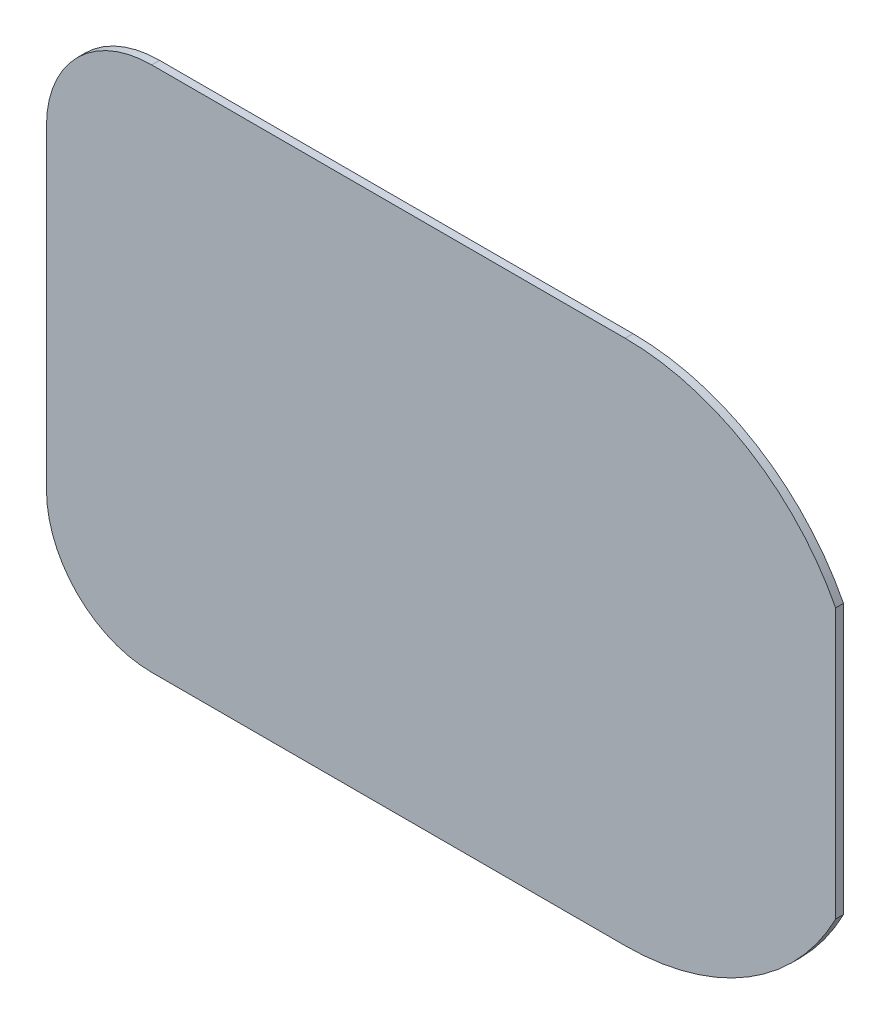
from build123d import *

# Parameters (mm, degrees)
EXTRUDE_1_DEPTH         = 3
EXTRUDE_START           = -42
EXTRUDE_2_OUTLINE_W     = 3
EXTRUDE_2_OUTLINE_H     = 100
EXTRUDE_2_DEPTH         = 41
EXTRUDE_START_2         = -1
EXTRUDE_2_2_OUTLINE_R   = 2
EXTRUDE_2_2_OUTLINE_W   = 10
EXTRUDE_2_2_OUTLINE_H   = 120
EXTRUDE_2_2_OUTLINE_R_2 = 52
EXTRUDE_2_2_DEPTH       = 4
EXTRUDE_START_3         = -47
EXTRUDE_2_3_OUTLINE_W   = 3
EXTRUDE_2_3_OUTLINE_H   = 100
EXTRUDE_2_3_DEPTH       = 5
EXTRUDE_2_4_DEPTH       = 180
EXTRUDE_START_4         = -5
EXTRUDE_2_5_DEPTH       = 5
EXTRUDE_START_5         = -3
SKETCH_3_R              = 52
SKETCH_3_W              = 10
SKETCH_3_H              = 120
EXTRUDE_3_DEPTH         = 3
SKETCH_4_R              = 2
EXTRUDE_4_DEPTH         = 3
EXTRUDE_START_6         = -56
SKETCH_5_R              = 2
EXTRUDE_5_DEPTH         = 56
SKETCH_6_W              = 375.582573206
SKETCH_6_H              = 223.737414549
CUT_EXTRUDE_1_DEPTH     = 70
CUT_EXTRUDE_2_DEPTH     = 126
SKETCH_8_W              = 410.596490254
SKETCH_8_H              = 121.986596881
CUT_EXTRUDE_3_DEPTH     = 10
SKETCH_9_W              = 309.492357762
SKETCH_9_H              = 10
EXTRUDE_6_DEPTH         = 3
SKETCH_10_W             = 76.162490496
SKETCH_10_H             = 157.997962214
CUT_EXTRUDE_4_DEPTH     = 10


with BuildPart() as part:
    # 草图1 → 凸台-拉伸1 (new body)
    with BuildSketch(Plane(origin=(-1, 0, 0), x_dir=(0, 0, -1), z_dir=(1, 0, 0))):
        Polygon((33.371794872, 92.353263785), (31.902170139, 91.718942203), (33.371794872, 91.084620622), align=None)
    extrude(amount=-EXTRUDE_1_DEPTH)

    # 凸台-拉伸2: read off the stored shape, not the designer's step
    # 凸台-拉伸2 outline → 凸台-拉伸2 (add)
    with BuildSketch(Plane.XY.offset(EXTRUDE_START)):
        with Locations((-2.5, 90)):
            Rectangle(EXTRUDE_2_OUTLINE_W, EXTRUDE_2_OUTLINE_H)
    extrude(amount=EXTRUDE_2_DEPTH)

    # Extrude 2 2 outline → Extrude 2 2 (add)
    with BuildSketch(Plane.XY.offset(EXTRUDE_START_2)):
        with BuildLine():
            Line((-4, 140), (-4, 40))
            Line((-4, 40), (0, 40))
            ThreePointArc((0, 40), (11.715728753, 11.715728753), (40, 0))
            Line((40, 0), (220, 0))
            ThreePointArc((220, 0), (310, 90), (220, 180))
            Line((220, 180), (40, 180))
            ThreePointArc((40, 180), (11.715728753, 168.284271247), (0, 140))
            Line((0, 140), (-4, 140))
        make_face()
        with Locations((248.3, 165.059930776)):
            Circle(EXTRUDE_2_2_OUTLINE_R, mode=Mode.SUBTRACT)
        with Locations((28, 14)):
            Circle(EXTRUDE_2_2_OUTLINE_R, mode=Mode.SUBTRACT)
        with Locations((139.15, 14)):
            Circle(EXTRUDE_2_2_OUTLINE_R, mode=Mode.SUBTRACT)
        with Locations((27.7366, 79.2634)):
            Circle(EXTRUDE_2_2_OUTLINE_R, mode=Mode.SUBTRACT)
        with Locations((248.3, 14.940069224)):
            Circle(EXTRUDE_2_2_OUTLINE_R, mode=Mode.SUBTRACT)
        with Locations((27.7366, 104.2634)):
            Circle(EXTRUDE_2_2_OUTLINE_R, mode=Mode.SUBTRACT)
        with Locations((107.15, 90)):
            Rectangle(EXTRUDE_2_2_OUTLINE_W, EXTRUDE_2_2_OUTLINE_H, mode=Mode.SUBTRACT)
        with Locations((137.15, 90)):
            Rectangle(EXTRUDE_2_2_OUTLINE_W, EXTRUDE_2_2_OUTLINE_H, mode=Mode.SUBTRACT)
        with Locations((28, 166)):
            Circle(EXTRUDE_2_2_OUTLINE_R, mode=Mode.SUBTRACT)
        with Locations((139.15, 166)):
            Circle(EXTRUDE_2_2_OUTLINE_R, mode=Mode.SUBTRACT)
        with Locations((220, 90)):
            Circle(EXTRUDE_2_2_OUTLINE_R_2, mode=Mode.SUBTRACT)
    extrude(amount=EXTRUDE_2_2_DEPTH)

    # Extrude 2 3 outline → Extrude 2 3 (add)
    with BuildSketch(Plane.XY.offset(EXTRUDE_START_3)):
        with Locations((-2.5, 90)):
            Rectangle(EXTRUDE_2_3_OUTLINE_W, EXTRUDE_2_3_OUTLINE_H)
    extrude(amount=EXTRUDE_2_3_DEPTH)

    # Extrude 2 4 outline → Extrude 2 4 (cut)
    with BuildSketch(Plane(origin=(0, 0, 0), x_dir=(1, 0, 0), z_dir=(0, 1, 0))):
        with BuildLine():
            Line((311, 0), (311, 1))
            Line((311, 1), (-1, 1))
            ThreePointArc((-1, 1), (-0.707106781, 0.292893219), (0, 0))
            Line((0, 0), (311, 0))
        make_face()
        with BuildLine():
            Line((102.15, -4), (102.15, -3))
            Line((102.15, -3), (0, -3))
            ThreePointArc((0, -3), (-2.828427125, -1.828427125), (-4, 1))
            Line((-4, 1), (-4, 2))
            Line((-4, 2), (-5, 2))
            Line((-5, 2), (-5, -4))
            Line((-5, -4), (102.15, -4))
        make_face()
    extrude(amount=EXTRUDE_2_4_DEPTH, mode=Mode.SUBTRACT)

    # Extrude 2 5 outline → Extrude 2 5 (cut)
    with BuildSketch(Plane.YZ.offset(EXTRUDE_START_4)):
        with BuildLine():
            ThreePointArc((45, -47), (41.464466094, -45.535533906), (40, -42))
            Line((40, -42), (40, -41))
            Line((40, -41), (39, -41))
            Line((39, -41), (39, -46.999999996))
            Line((39, -46.999999996), (45, -47))
        make_face()
        with BuildLine():
            ThreePointArc((140, -42), (138.535533906, -45.535533906), (135, -47))
            Line((135, -47), (141, -46.999999996))
            Line((141, -46.999999996), (141, -41))
            Line((141, -41), (140, -41))
            Line((140, -41), (140, -42))
        make_face()
    extrude(amount=EXTRUDE_2_5_DEPTH, mode=Mode.SUBTRACT)

    # 草图3 → 凸台-拉伸3 (add)
    with BuildSketch(Plane.XY.offset(3).offset(EXTRUDE_START_5)):
        with Locations((220, 90)):
            Circle(SKETCH_3_R)
        with Locations((107.15, 90)):
            Rectangle(SKETCH_3_W, SKETCH_3_H)
        with Locations((137.15, 90)):
            Rectangle(SKETCH_3_W, SKETCH_3_H)
    extrude(amount=EXTRUDE_3_DEPTH)

    # 草图4 → 凸台-拉伸4 (add)
    with BuildSketch(Plane.XY.offset(3).offset(EXTRUDE_START_5)):
        with Locations((27.7366, 79.2634)):
            Circle(SKETCH_4_R)
        with Locations((27.7366, 104.2634)):
            Circle(SKETCH_4_R)
    extrude(amount=EXTRUDE_4_DEPTH)

    # 草图5 → 凸台-拉伸5 (add)
    with BuildSketch(Plane.XY.offset(3).offset(EXTRUDE_START_6)):
        with Locations((248.3, 14.940069224)):
            Circle(SKETCH_5_R)
        with Locations((139.15, 14)):
            Circle(SKETCH_5_R)
        with Locations((248.3, 165.059930776)):
            Circle(SKETCH_5_R)
        with Locations((139.15, 166)):
            Circle(SKETCH_5_R)
        with Locations((28, 14)):
            Circle(SKETCH_5_R)
        with Locations((28, 166)):
            Circle(SKETCH_5_R)
    extrude(amount=EXTRUDE_5_DEPTH)

    # 草图6 → 切除-拉伸1 (cut)
    with BuildSketch(Plane(origin=(0, 0, 0), x_dir=(-1, 0, 0), z_dir=(0, 0, -1))):
        with Locations((-149.296459545, 93.267829814)):
            Rectangle(SKETCH_6_W, SKETCH_6_H)
    extrude(amount=CUT_EXTRUDE_1_DEPTH, mode=Mode.SUBTRACT)

    # 草图7 → 切除-拉伸2 (cut)
    with BuildSketch(Plane.XZ.offset(-40)):
        with BuildLine():
            Line((-3.872983346, 0), (0, 0))
            Line((0, 0), (0, 3))
            ThreePointArc((0, 3), (-2.449489743, 2.16227766), (-3.872983346, 0))
        make_face()
    extrude(amount=-CUT_EXTRUDE_2_DEPTH, mode=Mode.SUBTRACT)

    # 草图8 → 切除-拉伸3 (cut)
    with BuildSketch(Plane(origin=(0, 0, 0), x_dir=(-1, 0, 0), z_dir=(0, 0, -1))):
        with Locations((-160.461750975, 150.993298441)):
            Rectangle(SKETCH_8_W, SKETCH_8_H)
    extrude(amount=-CUT_EXTRUDE_3_DEPTH, mode=Mode.SUBTRACT)

    # 草图9 → 凸台-拉伸6 (add)
    with BuildSketch(Plane(origin=(0, 0, 0), x_dir=(-1, 0, 0), z_dir=(0, 0, -1))):
        with Locations((-154.746178881, 95)):
            Rectangle(SKETCH_9_W, SKETCH_9_H)
    extrude(amount=-EXTRUDE_6_DEPTH)

    # 镜向1: part across plane


with BuildPart() as part_1:
    add(part.part)
    add(part.part.mirror(Plane(origin=(309.492357762, 100, 312.653870495), x_dir=(0, 0, 1), z_dir=(0, 1, 0))))

    # 草图10 → 切除-拉伸4 (cut)
    with BuildSketch(Plane(origin=(0, 0, 0), x_dir=(-1, 0, 0), z_dir=(0, 0, -1))):
        with Locations((-338.081245248, 107.574371838)):
            Rectangle(SKETCH_10_W, SKETCH_10_H)
    extrude(amount=-CUT_EXTRUDE_4_DEPTH, mode=Mode.SUBTRACT)


solid = part_1.part
